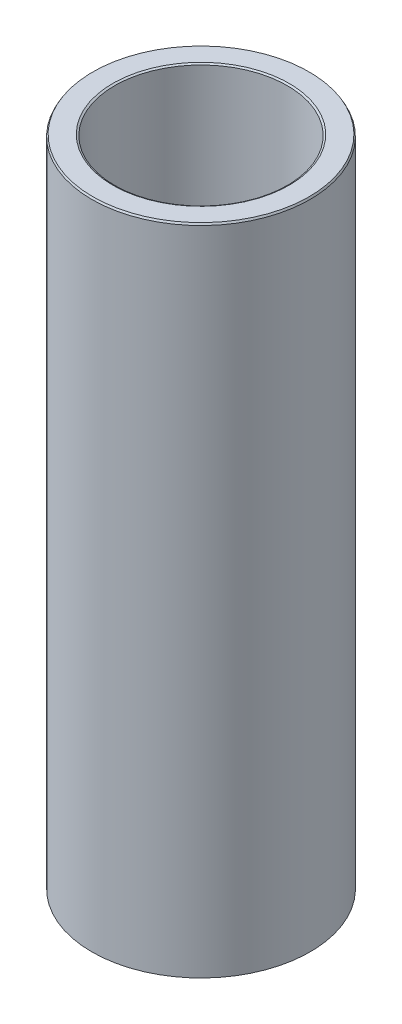
from build123d import *
from OCP.BRepFilletAPI import BRepFilletAPI_MakeChamfer

# Parameters (mm, degrees)
SKETCH1_R           = 37.5
BOSS_EXTRUDE1_DEPTH = 224.75570666
SKETCH2_R           = 29.670578664
CUT_EXTRUDE1_DEPTH  = 231.927754235
CHAMFER1_SIZE       = 0.621645494
CHAMFER1_SIZE2      = 0.358907193


with BuildPart() as part:
    # Sketch1 → Boss-Extrude1 (new body)
    with BuildSketch(Plane(origin=(0, 0, 0), x_dir=(1, 0, 0), z_dir=(0, 1, 0))):
        Circle(SKETCH1_R)
    extrude(amount=BOSS_EXTRUDE1_DEPTH)

    # Sketch2 → Cut-Extrude1 (cut, through all)
    with BuildSketch(Plane(origin=(0, 0, 0), x_dir=(1, 0, 0), z_dir=(0, 1, 0))):
        Circle(SKETCH2_R)
    extrude(amount=CUT_EXTRUDE1_DEPTH, mode=Mode.SUBTRACT)

    # Chamfer1: one chamfer whose edges measure the first distance from different faces: ONE call of the kernel's chamfer builder (chamfer() names one face for all edges)
    chamfer1_edges_1 = [part.edges().sort_by_distance(p)[0] for p in [
        (-29.670578664, 224.75570666, 0),
    ]]
    chamfer1_side_1 = [part.faces().sort_by_distance(p)[0] for p in [
        (-36.439339828, 224.75570666, 0),
    ]]
    chamfer1_edges_2 = [part.edges().sort_by_distance(p)[0] for p in [
        (-29.670578664, 0, 0),
    ]]
    chamfer1_side_2 = [part.faces().sort_by_distance(p)[0] for p in [
        (-29.670578664, 112.37785333, 0),
    ]]
    chamfer1_edges_3 = [part.edges().sort_by_distance(p)[0] for p in [
        (-37.5, 0, 0),
    ]]
    chamfer1_side_3 = [part.faces().sort_by_distance(p)[0] for p in [
        (-36.439339828, 0, 0),
    ]]
    chamfer1_edges_4 = [part.edges().sort_by_distance(p)[0] for p in [
        (-37.5, 224.75570666, 0),
    ]]
    chamfer1_side_4 = [part.faces().sort_by_distance(p)[0] for p in [
        (-37.5, 112.37785333, 0),
    ]]
    chamfer1 = BRepFilletAPI_MakeChamfer(part.part.solid().wrapped)
    for e in chamfer1_edges_1:
        chamfer1.Add(CHAMFER1_SIZE, CHAMFER1_SIZE2, e.wrapped, chamfer1_side_1[0].wrapped)  # the first distance lies on this face
    for e in chamfer1_edges_2:
        chamfer1.Add(CHAMFER1_SIZE, CHAMFER1_SIZE2, e.wrapped, chamfer1_side_2[0].wrapped)  # the first distance lies on this face
    for e in chamfer1_edges_3:
        chamfer1.Add(CHAMFER1_SIZE, CHAMFER1_SIZE2, e.wrapped, chamfer1_side_3[0].wrapped)  # the first distance lies on this face
    for e in chamfer1_edges_4:
        chamfer1.Add(CHAMFER1_SIZE, CHAMFER1_SIZE2, e.wrapped, chamfer1_side_4[0].wrapped)  # the first distance lies on this face
    add(Compound.cast(chamfer1.Shape()), mode=Mode.REPLACE)


solid = part.part
